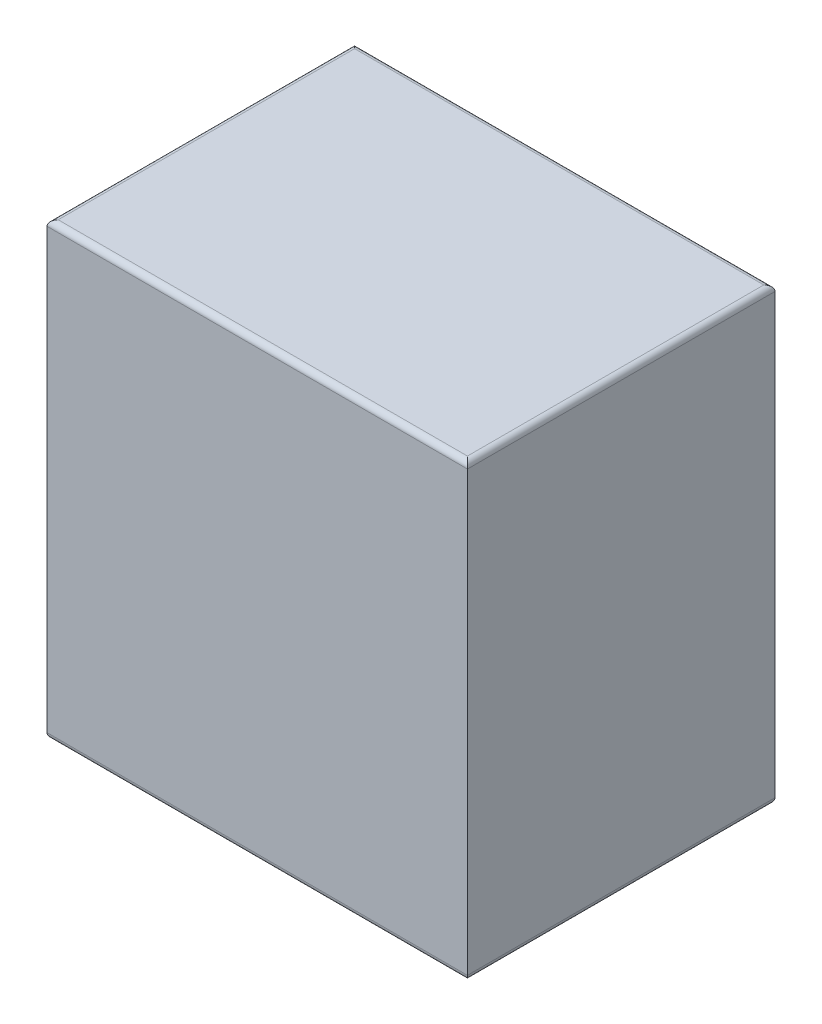
from build123d import *

# Parameters (mm, degrees)
SKETCH1_W           = 37.4
SKETCH1_H           = 27.36
BOSS_EXTRUDE1_DEPTH = 40
FILLET1_R           = 0.5


with BuildPart() as part:
    # Sketch1 → Boss-Extrude1 (new body)
    with BuildSketch(Plane(origin=(0, 0, 0), x_dir=(1, 0, 0), z_dir=(0, 1, 0))):
        with Locations((18.7, 13.68)):
            Rectangle(SKETCH1_W, SKETCH1_H)
    extrude(amount=BOSS_EXTRUDE1_DEPTH)

    # Fillet1
    fillet1_edges = [part.edges().sort_by_distance(p)[0] for p in [
        (18.7, 0, 0),
        (37.4, 0, -13.68),
        (18.7, 0, -27.36),
        (0, 0, -13.68),
        (18.7, 40, -27.36),
        (37.4, 40, -13.68),
        (18.7, 40, 0),
        (0, 40, -13.68),
    ]]
    fillet(fillet1_edges, radius=FILLET1_R)


solid = part.part
